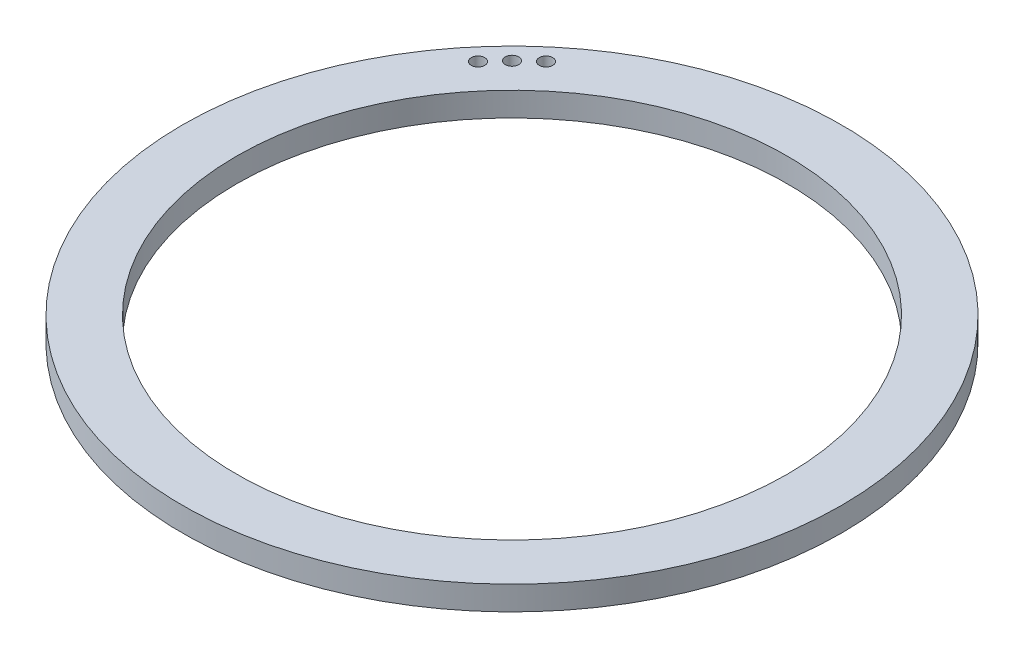
from build123d import *

# Parameters (mm, degrees)
SKETCH1_W                       = 28.575
SKETCH1_H                       = 12.7
F_9_32_0_28125_DIAMETER_HOLE1_D = 7.14375


with BuildPart() as part:
    # Sketch1 → Revolve1 (revolve)
    with BuildSketch(Plane.XY):
        with Locations((159.813733777, 200.022409282)):
            Rectangle(SKETCH1_W, SKETCH1_H)
    revolve(axis=Axis((1e-09, -200000, 0), (0, 1, 0)))

    # 9/32 (0.28125) Diameter Hole1 (through all)
    with Locations(Plane(origin=(0, 206.372409282, 0), x_dir=(1, 0, 0), z_dir=(0, 1, 0))):
        with Locations((-116.372970926, 116.372970926), (-107.045703742, 125.006215984), (-125.006215984, 107.045703742)):
            Hole(F_9_32_0_28125_DIAMETER_HOLE1_D / 2)


solid = part.part
